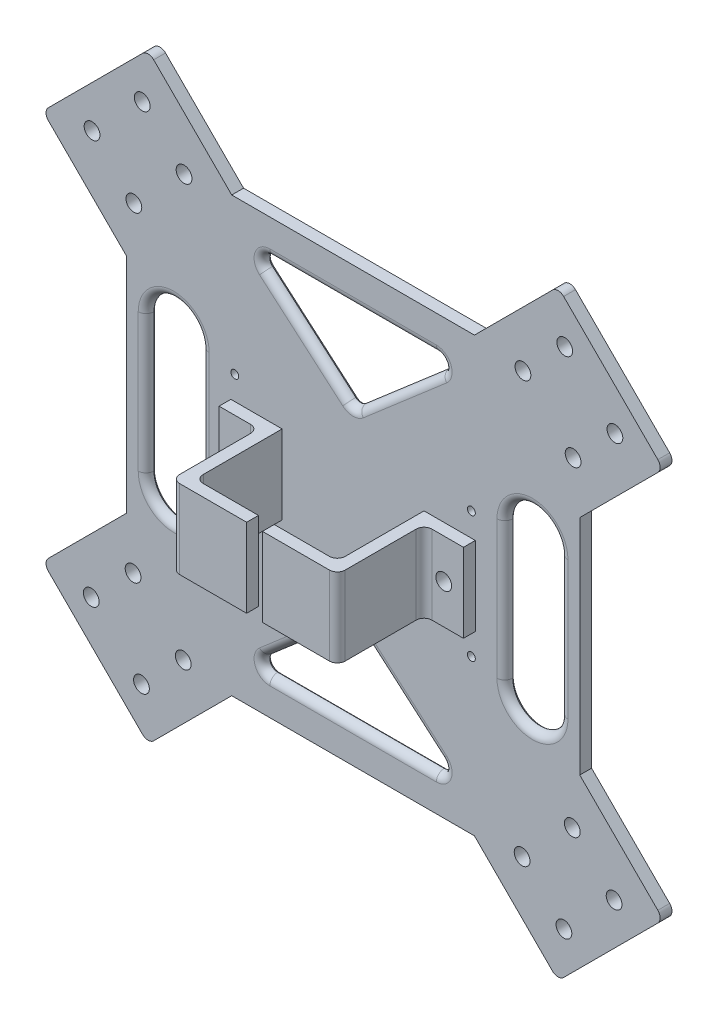
from build123d import *

# Parameters (mm, degrees)
SKETCH1_R           = 1
BOSS_EXTRUDE1_DEPTH = 3
SKETCH2_R           = 2
CUT_EXTRUDE1_DEPTH  = 110.604839186
FILLET1_R           = 2
FILLET2_R           = 2
FILLET3_R           = 2
BOSS_EXTRUDE2_DEPTH = 10
SKETCH4_R           = 2
CUT_EXTRUDE2_DEPTH  = 111.602454224


with BuildPart() as part:
    # Sketch1 → Boss-Extrude1 (new body)
    with BuildSketch(Plane.XY):
        Polygon((78.713203436, 49.493203436), (57.5, 28.28), (57.5, -28.28), (78.713203436, -49.493203436), (51.993203436, -76.213203436), (30.78, -55), (-30.78, -55), (-51.993203436, -76.213203436), (-78.713203436, -49.493203436), (-57.5, -28.28), (-57.5, 28.28), (-78.713203436, 49.493203436), (-51.993203436, 76.213203436), (-30.78, 55), (30.78, 55), (51.993203436, 76.213203436), align=None)
        with Locations((30, -16)):
            Circle(SKETCH1_R, mode=Mode.SUBTRACT)
        with Locations((30, 16)):
            Circle(SKETCH1_R, mode=Mode.SUBTRACT)
        with Locations((-30, -16)):
            Circle(SKETCH1_R, mode=Mode.SUBTRACT)
        with Locations((-30, 16)):
            Circle(SKETCH1_R, mode=Mode.SUBTRACT)
    extrude(amount=BOSS_EXTRUDE1_DEPTH)

    # Sketch2 → Cut-Extrude1 (cut, through all)
    with BuildSketch(Plane.XY.offset(3)):
        with Locations((43.079339828, 53.30726189)):
            Circle(SKETCH2_R)
        with Locations((53.685941546, 63.913863607)):
            Circle(SKETCH2_R)
        with Locations((55.80726189, 40.579339828)):
            Circle(SKETCH2_R)
        with Locations((66.413863607, 51.185941546)):
            Circle(SKETCH2_R)
        with Locations((-66.413863607, -51.185941546)):
            Circle(SKETCH2_R)
        with Locations((-55.80726189, -40.579339828)):
            Circle(SKETCH2_R)
        with Locations((-43.079339828, -53.30726189)):
            Circle(SKETCH2_R)
        with Locations((-53.685941546, -63.913863607)):
            Circle(SKETCH2_R)
        with Locations((-53.479114875, 64.120690278)):
            Circle(SKETCH2_R)
        with Locations((-42.872513158, 53.51408856)):
            Circle(SKETCH2_R)
        with Locations((-55.600435219, 40.786166499)):
            Circle(SKETCH2_R)
        with Locations((-66.207036937, 51.392768217)):
            Circle(SKETCH2_R)
        with Locations((55.600435219, -40.786166499)):
            Circle(SKETCH2_R)
        with Locations((42.872513157, -53.51408856)):
            Circle(SKETCH2_R)
        with Locations((66.207036937, -51.392768217)):
            Circle(SKETCH2_R)
        with Locations((53.479114875, -64.120690278)):
            Circle(SKETCH2_R)
        with BuildLine():
            Line((-21.115499019, 46), (21.115499019, 46))
            ThreePointArc((21.115499019, 46), (22.990027524, 44.697239474), (22.422494287, 42.486142884))
            Line((22.422494287, 42.486142884), (1.306995268, 24.255982976))
            ThreePointArc((1.306995268, 24.255982976), (0, 23.769840093), (-1.306995268, 24.255982976))
            Line((-1.306995268, 24.255982976), (-22.422494287, 42.486142884))
            ThreePointArc((-22.422494287, 42.486142884), (-22.990027524, 44.697239474), (-21.115499019, 46))
        make_face()
        with BuildLine():
            Line((21.115499019, -46), (-21.115499019, -46))
            ThreePointArc((-21.115499019, -46), (-22.990027524, -44.697239474), (-22.422494287, -42.486142884))
            Line((-22.422494287, -42.486142884), (-1.306995268, -24.255982976))
            ThreePointArc((-1.306995268, -24.255982976), (0, -23.769840093), (1.306995268, -24.255982976))
            Line((1.306995268, -24.255982976), (22.422494287, -42.486142884))
            ThreePointArc((22.422494287, -42.486142884), (22.990027524, -44.697239474), (21.115499019, -46))
        make_face()
        with BuildLine():
            Line((-38.5, 17.5), (-38.5, -17.5))
            ThreePointArc((-38.5, -17.5), (-45.5, -24.5), (-52.5, -17.5))
            Line((-52.5, -17.5), (-52.5, 17.5))
            ThreePointArc((-52.5, 17.5), (-45.5, 24.5), (-38.5, 17.5))
        make_face()
        with BuildLine():
            Line((38.5, 17.5), (38.5, -17.5))
            ThreePointArc((38.5, -17.5), (45.5, -24.5), (52.5, -17.5))
            Line((52.5, -17.5), (52.5, 17.5))
            ThreePointArc((52.5, 17.5), (45.5, 24.5), (38.5, 17.5))
        make_face()
    extrude(amount=-CUT_EXTRUDE1_DEPTH, mode=Mode.SUBTRACT)

    # Fillet1
    fillet1_edges = [part.edges().sort_by_distance(p)[0] for p in [
        (78.713203436, -49.493203436, 1.5),
        (51.993203436, -76.213203436, 1.5),
        (-51.993203436, -76.213203436, 1.5),
        (-78.713203436, -49.493203436, 1.5),
        (-78.713203436, 49.493203436, 1.5),
        (-51.993203436, 76.213203436, 1.5),
        (51.993203436, 76.213203436, 1.5),
        (78.713203436, 49.493203436, 1.5),
    ]]
    fillet(fillet1_edges, radius=FILLET1_R)

    # Fillet2
    fillet2_edges = [part.edges().sort_by_distance(p)[0] for p in [
        (0, 23.769840093, 3),
        (11.864744778, 33.37106293, 3),
        (22.990027524, 44.697239474, 3),
        (0, 46, 3),
        (-22.990027524, 44.697239474, 3),
        (-11.864744778, 33.37106293, 3),
        (-45.5, 24.5, 3),
        (-52.5, 0, 3),
        (-45.5, -24.5, 3),
        (-38.5, 0, 3),
        (0, -23.769840093, 3),
        (-11.864744778, -33.37106293, 3),
        (-22.990027524, -44.697239474, 3),
        (0, -46, 3),
        (22.990027524, -44.697239474, 3),
        (11.864744778, -33.37106293, 3),
        (45.5, 24.5, 3),
        (38.5, 0, 3),
        (45.5, -24.5, 3),
        (52.5, 0, 3),
    ]]
    fillet(fillet2_edges, radius=FILLET2_R)

    # Fillet3
    # the kernel refuses this fillet: 2 mm, written as the material it takes off along each edge
    with BuildSketch(Plane(origin=(21.115499019, 46, 0), x_dir=(0, 0, 1), z_dir=(-1, 0, 0))) as fillet3_piece_1:
        with BuildLine():
            CenterArc((2, 1.732050808), FILLET3_R, 180, 60)
            Line((0, 1.732050808), (-0.04, 1.732050808))
            Line((-0.04, 1.732050808), (-0.04, 0))
            Line((-0.04, 0), (0, -0.04))
            ThreePointArc((0, -0.04), (0.5, -0.04), (0.98, -0.034641016))
            Line((0.98, -0.034641016), (1, 0))
        make_face()
    extrude(amount=42.230998037, mode=Mode.SUBTRACT)
    with BuildSketch(Plane(origin=(21.115499019, 44, 0), x_dir=(0.6534976341785956, -0.7569285581367495, 0), z_dir=(-0.7569285581367495, -0.6534976341785956, 0))) as fillet3_piece_2:
        with BuildLine():
            CenterArc((3.732050808, 2), FILLET3_R, 210, 60)
            Line((3.732050808, 0), (3.732050808, -0.04))
            Line((3.732050808, -0.04), (2, -0.04))
            Line((2, -0.04), (1.96, 0))
            ThreePointArc((1.96, 0), (1.96, 0.5), (1.965358984, 0.98))
            Line((1.965358984, 0.98), (2, 1))
        make_face()
    revolve(axis=Axis((21.115499019, 44, 0), (0, 0, 1)), revolution_arc=139.194169449, mode=Mode.SUBTRACT)
    with BuildSketch(Plane(origin=(1.306995268, 24.255982976, 0), x_dir=(0, 0, 1), z_dir=(0.7569285581367493, 0.6534976341785957, 0)), Plane(origin=(-22.422494287, 42.486142884, 0), x_dir=(0, 0, 1), z_dir=(0.7569285581367498, -0.6534976341785953, 0))) as fillet3_piece_3:
        with BuildLine():
            CenterArc((2, 1.732050808), FILLET3_R, 180, 60)
            Line((0, 1.732050808), (-0.04, 1.732050808))
            Line((-0.04, 1.732050808), (-0.04, 0))
            Line((-0.04, 0), (0, -0.04))
            ThreePointArc((0, -0.04), (0.5, -0.04), (0.98, -0.034641016))
            Line((0.98, -0.034641016), (1, 0))
        make_face()
    extrude(amount=27.896290597, mode=Mode.SUBTRACT)
    with BuildSketch(Plane(origin=(0, 25.769840093, 0), x_dir=(-0.653497634178595, -0.75692855813675, 0), z_dir=(-0.75692855813675, 0.653497634178595, 0))) as fillet3_piece_4:
        with BuildLine():
            CenterArc((3.732050808, 2), FILLET3_R, 210, 60)
            Line((3.732050808, 0), (3.732050808, -0.04))
            Line((3.732050808, -0.04), (2, -0.04))
            Line((2, -0.04), (1.96, 0))
            ThreePointArc((1.96, 0), (1.96, 0.5), (1.965358984, 0.98))
            Line((1.965358984, 0.98), (2, 1))
        make_face()
    revolve(axis=Axis((0, 25.769840093, 0), (0, 0, 1)), revolution_arc=81.611661103, mode=Mode.SUBTRACT)
    with BuildSketch(Plane(origin=(-52.5, 17.5, 0), x_dir=(-1, 0, 0), z_dir=(0, -1, 0)), Plane(origin=(-38.5, -17.5, 0), x_dir=(1, 0, 0), z_dir=(0, 1, 0))) as fillet3_piece_5:
        with BuildLine():
            CenterArc((1.732050808, -2), FILLET3_R, 90, 60)
            Line((0, -1), (-0.034641016, -0.98))
            ThreePointArc((-0.034641016, -0.98), (-0.04, -0.5), (-0.04, 0))
            Line((-0.04, 0), (0, 0.04))
            Line((0, 0.04), (1.732050808, 0.04))
            Line((1.732050808, 0.04), (1.732050808, 0))
        make_face()
    extrude(amount=35, mode=Mode.SUBTRACT)
    with BuildSketch(Plane(origin=(-45.5, 17.5, 0), x_dir=(1, 0, 0), z_dir=(0, -1, 0))) as fillet3_piece_6:
        with BuildLine():
            CenterArc((8.732050808, 2), FILLET3_R, 210, 60)
            Line((7, 1), (6.965358984, 0.98))
            ThreePointArc((6.965358984, 0.98), (6.96, 0.5), (6.96, 0))
            Line((6.96, 0), (7, -0.04))
            Line((7, -0.04), (8.732050808, -0.04))
            Line((8.732050808, -0.04), (8.732050808, 0))
        make_face()
    revolve(axis=Axis((-45.5, 17.5, 0), (0, 0, 1)), revolution_arc=180, mode=Mode.SUBTRACT)
    with BuildSketch(Plane(origin=(38.5, -17.5, 0), x_dir=(-1, 0, 0), z_dir=(0, 1, 0)), Plane(origin=(52.5, 17.5, 0), x_dir=(1, 0, 0), z_dir=(0, -1, 0))) as fillet3_piece_7:
        with BuildLine():
            CenterArc((1.732050808, 2), FILLET3_R, 210, 60)
            Line((0, 1), (-0.034641016, 0.98))
            ThreePointArc((-0.034641016, 0.98), (-0.04, 0.5), (-0.04, 0))
            Line((-0.04, 0), (0, -0.04))
            Line((0, -0.04), (1.732050808, -0.04))
            Line((1.732050808, -0.04), (1.732050808, 0))
        make_face()
    extrude(amount=35, mode=Mode.SUBTRACT)
    with BuildSketch(Plane(origin=(45.5, 17.5, 0), x_dir=(1, 0, 0), z_dir=(0, -1, 0))) as fillet3_piece_8:
        with BuildLine():
            CenterArc((8.732050808, 2), FILLET3_R, 210, 60)
            Line((7, 1), (6.965358984, 0.98))
            ThreePointArc((6.965358984, 0.98), (6.96, 0.5), (6.96, 0))
            Line((6.96, 0), (7, -0.04))
            Line((7, -0.04), (8.732050808, -0.04))
            Line((8.732050808, -0.04), (8.732050808, 0))
        make_face()
    revolve(axis=Axis((45.5, 17.5, 0), (0, 0, 1)), revolution_arc=180, mode=Mode.SUBTRACT)
    with BuildSketch(Plane(origin=(22.422494287, -42.486142884, 0), x_dir=(0.6534976341785951, 0.7569285581367498, 0), z_dir=(-0.7569285581367499, 0.6534976341785952, 0)), Plane(origin=(-1.306995268, -24.255982976, 0), x_dir=(-0.653497634178596, 0.7569285581367492, 0), z_dir=(-0.7569285581367492, -0.653497634178596, 0))) as fillet3_piece_9:
        with BuildLine():
            CenterArc((1.732050808, -2), FILLET3_R, 90, 60)
            Line((0, -1), (-0.034641016, -0.98))
            ThreePointArc((-0.034641016, -0.98), (-0.04, -0.5), (-0.04, 0))
            Line((-0.04, 0), (0, 0.04))
            Line((0, 0.04), (1.732050808, 0.04))
            Line((1.732050808, 0.04), (1.732050808, 0))
        make_face()
    extrude(amount=27.896290597, mode=Mode.SUBTRACT)
    with BuildSketch(Plane(origin=(21.115499019, -44, 0), x_dir=(0, -1, 0), z_dir=(-1, 0, 0))) as fillet3_piece_10:
        with BuildLine():
            CenterArc((3.732050808, 2), FILLET3_R, 210, 60)
            Line((2, 1), (1.965358984, 0.98))
            ThreePointArc((1.965358984, 0.98), (1.96, 0.5), (1.96, 0))
            Line((1.96, 0), (2, -0.04))
            Line((2, -0.04), (3.732050808, -0.04))
            Line((3.732050808, -0.04), (3.732050808, 0))
        make_face()
    revolve(axis=Axis((21.115499019, -44, 0), (0, 0, 1)), revolution_arc=139.194169449, mode=Mode.SUBTRACT)
    with BuildSketch(Plane(origin=(-21.115499019, -46, 0), x_dir=(0, -1, 0), z_dir=(1, 0, 0))) as fillet3_piece_11:
        with BuildLine():
            CenterArc((1.732050808, -2), FILLET3_R, 90, 60)
            Line((0, -1), (-0.034641016, -0.98))
            ThreePointArc((-0.034641016, -0.98), (-0.04, -0.5), (-0.04, 0))
            Line((-0.04, 0), (0, 0.04))
            Line((0, 0.04), (1.732050808, 0.04))
            Line((1.732050808, 0.04), (1.732050808, 0))
        make_face()
    extrude(amount=42.230998037, mode=Mode.SUBTRACT)
    with BuildSketch(Plane(origin=(-21.115499019, -44, 0), x_dir=(-0.6534976341785966, 0.7569285581367486, 0), z_dir=(0.7569285581367486, 0.6534976341785966, 0))) as fillet3_piece_12:
        with BuildLine():
            CenterArc((3.732050808, 2), FILLET3_R, 210, 60)
            Line((2, 1), (1.965358984, 0.98))
            ThreePointArc((1.965358984, 0.98), (1.96, 0.5), (1.96, 0))
            Line((1.96, 0), (2, -0.04))
            Line((2, -0.04), (3.732050808, -0.04))
            Line((3.732050808, -0.04), (3.732050808, 0))
        make_face()
    revolve(axis=Axis((-21.115499019, -44, 0), (0, 0, 1)), revolution_arc=139.194169449, mode=Mode.SUBTRACT)
    with BuildSketch(Plane(origin=(-21.115499019, 44, 0), x_dir=(0, 1, 0), z_dir=(1, 0, 0))) as fillet3_piece_13:
        with BuildLine():
            CenterArc((3.732050808, 2), FILLET3_R, 210, 60)
            Line((3.732050808, 0), (3.732050808, -0.04))
            Line((3.732050808, -0.04), (2, -0.04))
            Line((2, -0.04), (1.96, 0))
            ThreePointArc((1.96, 0), (1.96, 0.5), (1.965358984, 0.98))
            Line((1.965358984, 0.98), (2, 1))
        make_face()
    revolve(axis=Axis((-21.115499019, 44, 0), (0, 0, 1)), revolution_arc=139.194169449, mode=Mode.SUBTRACT)
    with BuildSketch(Plane(origin=(-45.5, -17.5, 0), x_dir=(-1, 0, 0), z_dir=(0, 1, 0))) as fillet3_piece_14:
        with BuildLine():
            CenterArc((8.732050808, 2), FILLET3_R, 210, 60)
            Line((7, 1), (6.965358984, 0.98))
            ThreePointArc((6.965358984, 0.98), (6.96, 0.5), (6.96, 0))
            Line((6.96, 0), (7, -0.04))
            Line((7, -0.04), (8.732050808, -0.04))
            Line((8.732050808, -0.04), (8.732050808, 0))
        make_face()
    revolve(axis=Axis((-45.5, -17.5, 0), (0, 0, 1)), revolution_arc=180, mode=Mode.SUBTRACT)
    with BuildSketch(Plane(origin=(45.5, -17.5, 0), x_dir=(-1, 0, 0), z_dir=(0, 1, 0))) as fillet3_piece_15:
        with BuildLine():
            CenterArc((8.732050808, 2), FILLET3_R, 210, 60)
            Line((7, 1), (6.965358984, 0.98))
            ThreePointArc((6.965358984, 0.98), (6.96, 0.5), (6.96, 0))
            Line((6.96, 0), (7, -0.04))
            Line((7, -0.04), (8.732050808, -0.04))
            Line((8.732050808, -0.04), (8.732050808, 0))
        make_face()
    revolve(axis=Axis((45.5, -17.5, 0), (0, 0, 1)), revolution_arc=180, mode=Mode.SUBTRACT)
    with BuildSketch(Plane(origin=(0, -25.769840093, 0), x_dir=(0.6534976341785979, 0.7569285581367475, 0), z_dir=(0.7569285581367475, -0.6534976341785979, 0))) as fillet3_piece_16:
        with BuildLine():
            CenterArc((3.732050808, 2), FILLET3_R, 210, 60)
            Line((2, 1), (1.965358984, 0.98))
            ThreePointArc((1.965358984, 0.98), (1.96, 0.5), (1.96, 0))
            Line((1.96, 0), (2, -0.04))
            Line((2, -0.04), (3.732050808, -0.04))
            Line((3.732050808, -0.04), (3.732050808, 0))
        make_face()
    revolve(axis=Axis((0, -25.769840093, 0), (0, 0, 1)), revolution_arc=81.611661103, mode=Mode.SUBTRACT)

    # Sketch3 → Boss-Extrude2 (add, symmetric)
    with BuildSketch(Plane(origin=(0, 0, 0), x_dir=(-1, 0, 0), z_dir=(0, -1, 0))):
        with BuildLine():
            Line((-21, -8), (-21, -26))
            ThreePointArc((-21, -26), (-20.414213562, -27.414213562), (-19, -28))
            Line((-19, -28), (-2, -28))
            Line((-2, -28), (-2, -25))
            Line((-2, -25), (-16, -25))
            ThreePointArc((-16, -25), (-17.414213562, -24.414213562), (-18, -23))
            Line((-18, -23), (-18, -3))
            Line((-18, -3), (-31, -3))
            Line((-31, -3), (-31, -6))
            Line((-31, -6), (-23, -6))
            ThreePointArc((-23, -6), (-21.585786438, -6.585786438), (-21, -8))
        make_face()
        with BuildLine():
            Line((2, -28), (2, -25))
            Line((2, -25), (16, -25))
            ThreePointArc((16, -25), (17.414213562, -24.414213562), (18, -23))
            Line((18, -23), (18, -3))
            Line((18, -3), (31, -3))
            Line((31, -3), (31, -6))
            Line((31, -6), (23, -6))
            ThreePointArc((23, -6), (21.585786438, -6.585786438), (21, -8))
            Line((21, -8), (21, -26))
            ThreePointArc((21, -26), (20.414213562, -27.414213562), (19, -28))
            Line((19, -28), (2, -28))
        make_face()
    extrude(amount=BOSS_EXTRUDE2_DEPTH, both=True)

    # Sketch4 → Cut-Extrude2 (cut, through all)
    with BuildSketch(Plane.XY.offset(6)):
        with Locations((26, 0)):
            Circle(SKETCH4_R)
        with Locations(Location((-26, 0, 0), (0, 0, 180))):
            Circle(SKETCH4_R)
    extrude(amount=-CUT_EXTRUDE2_DEPTH, mode=Mode.SUBTRACT)


solid = part.part
